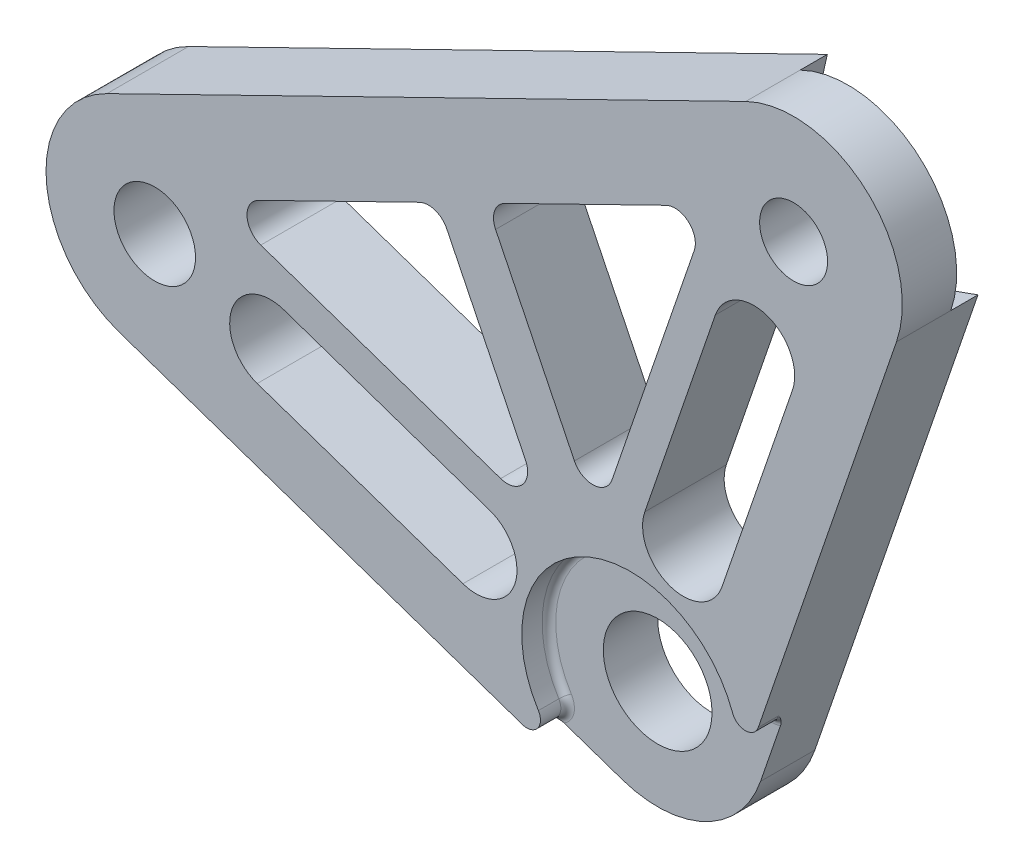
from build123d import *

# Parameters (mm, degrees)
SKETCH1_R               = 3
SKETCH1_R_2             = 4
SKETCH1_R_3             = 2.5
BOSS_EXTRUDE1_DEPTH     = 6
CUT_EXTRUDE1_DEPTH      = 62.10646447
CUT_EXTRUDE1_DEPTH_BACK = 62.10646447
CUT_EXTRUDE2_START      = -2
SKETCH4_R               = 8
CUT_EXTRUDE2_DEPTH      = 2
FILLET1_START           = 4
FILLET1_DEPTH           = 2
FILLET2_R               = 0.5
CUT_EXTRUDE4_DEPTH      = 2


with BuildPart() as part:
    # Sketch1 → Boss-Extrude1 (new body)
    with BuildSketch(Plane.XY):
        with BuildLine():
            Line((19.567567568, 32.405405405), (7.567567568, -2.594594595))
            ThreePointArc((7.567567568, -2.594594595), (3.516422912, -7.185733776), (-2.594594595, -7.567567568))
            Line((-2.594594595, -7.567567568), (-37.594594595, 4.432432432))
            ThreePointArc((-37.594594595, 4.432432432), (-42.984429152, 11.50111011), (-38.516422912, 19.185733776))
            Line((-38.516422912, 19.185733776), (8.483577088, 42.185733776))
            ThreePointArc((8.483577088, 42.185733776), (17.293075573, 40.998612422), (19.567567568, 32.405405405))
        make_face()
        with Locations((-35, 12)):
            Circle(SKETCH1_R, mode=Mode.SUBTRACT)
        Circle(SKETCH1_R_2, mode=Mode.SUBTRACT)
        with Locations((12, 35)):
            Circle(SKETCH1_R_3, mode=Mode.SUBTRACT)
    extrude(amount=BOSS_EXTRUDE1_DEPTH)

    # Sketch2 → Cut-Extrude1 (cut, two sides: drawn at the far end of the back side and taken through both)
    with BuildSketch(Plane.XY.offset(6).offset(-CUT_EXTRUDE1_DEPTH_BACK)):
        with BuildLine():
            Line((-27.3724879, 17.959246424), (-15.522864255, 23.75799842))
            ThreePointArc((-15.522864255, 23.75799842), (-14.377048473, 23.829592256), (-13.516209876, 23.070002633))
            Line((-13.516209876, 23.070002633), (-7.71745788, 11.220378988))
            ThreePointArc((-7.71745788, 11.220378988), (-7.940043134, 9.568598022), (-9.551269449, 9.142130773))
            Line((-9.551269449, 9.142130773), (-27.199645091, 15.193002422))
            ThreePointArc((-27.199645091, 15.193002422), (-28.21023907, 16.518379486), (-27.3724879, 17.959246424))
        make_face()
        with BuildLine():
            Line((-25.513513514, 11.918918919), (-10.378378378, 6.72972973))
            ThreePointArc((-10.378378378, 6.72972973), (-8.513513514, 2.918918919), (-12.324324324, 1.054054054))
            Line((-12.324324324, 1.054054054), (-27.459459459, 6.243243243))
            ThreePointArc((-27.459459459, 6.243243243), (-29.324324324, 10.054054054), (-25.513513514, 11.918918919))
        make_face()
        with BuildLine():
            Line((-9.923342988, 24.828214089), (-4.124590991, 12.978590444))
            ThreePointArc((-4.124590991, 12.978590444), (-2.683724054, 12.140839274), (-1.358346989, 13.151433254))
            Line((-1.358346989, 13.151433254), (4.692524659, 30.799808895))
            ThreePointArc((4.692524659, 30.799808895), (4.26605741, 32.41103521), (2.614276444, 32.633620464))
            Line((2.614276444, 32.633620464), (-9.235347201, 26.834868468))
            ThreePointArc((-9.235347201, 26.834868468), (-9.994936824, 25.974029871), (-9.923342988, 24.828214089))
        make_face()
        with BuildLine():
            Line((6.243243243, 27.459459459), (1.054054054, 12.324324324))
            ThreePointArc((1.054054054, 12.324324324), (2.918918919, 8.513513514), (6.72972973, 10.378378378))
            Line((6.72972973, 10.378378378), (11.918918919, 25.513513514))
            ThreePointArc((11.918918919, 25.513513514), (10.054054054, 29.324324324), (6.243243243, 27.459459459))
        make_face()
    extrude(amount=CUT_EXTRUDE1_DEPTH + CUT_EXTRUDE1_DEPTH_BACK, mode=Mode.SUBTRACT)

    # Sketch4 → Cut-Extrude2 (cut)
    with BuildSketch(Plane.XY.offset(6).offset(CUT_EXTRUDE2_START)):
        Circle(SKETCH4_R)
    extrude(amount=CUT_EXTRUDE2_DEPTH, mode=Mode.SUBTRACT)

    # Fillet1: read off the stored shape, not the designer's step
    # Fillet1 outline → Fillet1 (cut)
    with BuildSketch(Plane.XY.offset(FILLET1_START)):
        with BuildLine():
            ThreePointArc((9.402223, 2.75648375), (8.465816464, 2.080853575), (7.516690715, 2.738496066))
            ThreePointArc((7.516690715, 2.738496066), (7.999635991, 0.076315279), (7.567567568, -2.594594595))
            Line((7.567567568, -2.594594595), (9.402223, 2.75648375))
        make_face()
        with BuildLine():
            ThreePointArc((-2.594594595, -7.567567568), (-4.968729766, -6.269906261), (-6.774532102, -4.255081057))
            ThreePointArc((-6.774532102, -4.255081057), (-6.837610332, -5.40805741), (-7.945672939, -5.732912135))
            Line((-7.945672939, -5.732912135), (-2.594594595, -7.567567568))
        make_face()
    extrude(amount=FILLET1_DEPTH, mode=Mode.SUBTRACT)

    # Fillet2
    fillet2_edges = [part.edges().sort_by_distance(p)[0] for p in [
        (-3.516422912, 7.185733776, 4),
        (8.465816464, 2.080853575, 4),
        (-6.837610332, -5.40805741, 4),
    ]]
    fillet(fillet2_edges, radius=FILLET2_R)

    # Sketch5 → Cut-Extrude4 (cut)
    with BuildSketch(Plane(origin=(0, 0, 0), x_dir=(-1, 0, 0), z_dir=(0, 0, -1))):
        with BuildLine():
            Line((-7.12054628, 36.091298034), (-8.483577088, 42.185733776))
            ThreePointArc((-8.483577088, 42.185733776), (-17.293075573, 40.998612422), (-19.567567568, 32.405405405))
            Line((-19.567567568, 32.405405405), (-13.690203108, 30.2943424))
            ThreePointArc((-13.690203108, 30.2943424), (-8.691827767, 31.250867237), (-7.12054628, 36.091298034))
        make_face()
    extrude(amount=-CUT_EXTRUDE4_DEPTH, mode=Mode.SUBTRACT)


solid = part.part
